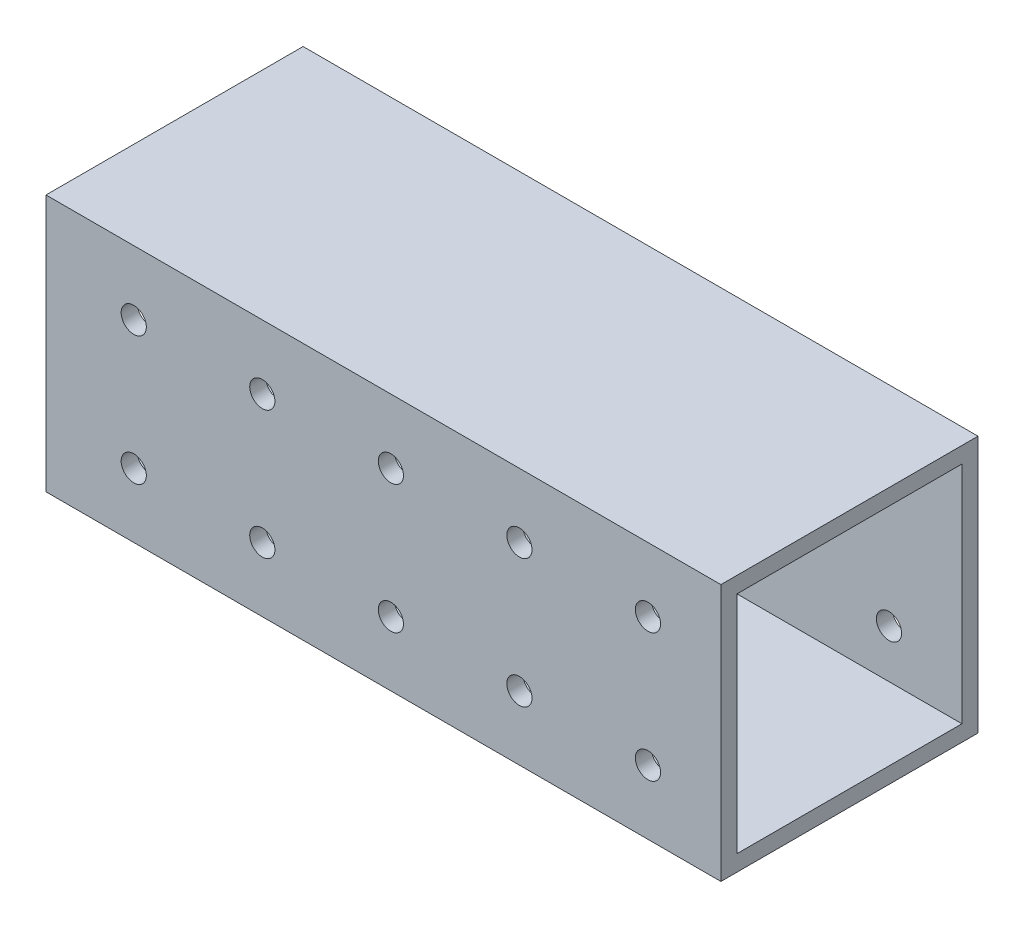
from build123d import *

# Parameters (mm, degrees)
SKETCH1_W           = 50.8
SKETCH1_H           = 50.8
BOSS_EXTRUDE1_DEPTH = 133.35
SHELL1_T            = -3.175
SKETCH2_R           = 2.4892
CUT_EXTRUDE1_DEPTH  = 152.471127612


with BuildPart() as part:
    # Sketch1 → Boss-Extrude1 (new body)
    with BuildSketch(Plane(origin=(0, 0, 0), x_dir=(0, 0, -1), z_dir=(1, 0, 0))):
        with Locations((25.4, 25.4)):
            Rectangle(SKETCH1_W, SKETCH1_H)
    extrude(amount=BOSS_EXTRUDE1_DEPTH)

    # Shell1
    shell1_openings = [part.faces().sort_by_distance(p)[0] for p in [
        (0, 25.4, -25.4),
        (133.35, 25.4, -25.4),
    ]]
    offset(amount=SHELL1_T, openings=shell1_openings, kind=Kind.INTERSECTION)

    # Sketch2 → Cut-Extrude1 (cut, through all)
    with BuildSketch(Plane(origin=(0, 0, -50.8), x_dir=(-1, 0, 0), z_dir=(0, 0, -1))):
        with Locations((-118.938330442, 38.1)):
            Circle(SKETCH2_R)
        with Locations((-93.538330442, 38.1)):
            Circle(SKETCH2_R)
        with Locations((-68.138330442, 38.1)):
            Circle(SKETCH2_R)
        with Locations((-42.738330442, 38.1)):
            Circle(SKETCH2_R)
        with Locations((-17.338330442, 38.1)):
            Circle(SKETCH2_R)
        with Locations((-17.338330442, 12.7)):
            Circle(SKETCH2_R)
        with Locations((-42.738330442, 12.7)):
            Circle(SKETCH2_R)
        with Locations((-68.138330442, 12.7)):
            Circle(SKETCH2_R)
        with Locations((-93.538330442, 12.7)):
            Circle(SKETCH2_R)
        with Locations((-118.938330442, 12.7)):
            Circle(SKETCH2_R)
    extrude(amount=-CUT_EXTRUDE1_DEPTH, mode=Mode.SUBTRACT)


solid = part.part
